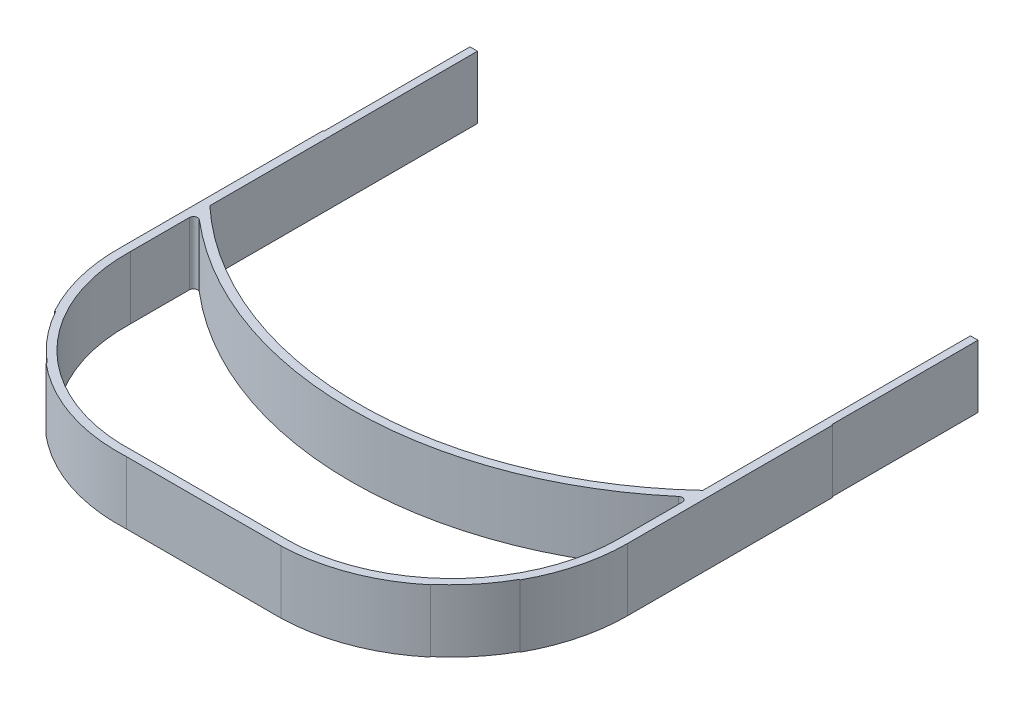
from build123d import *

# Parameters (mm, degrees)
EXTRUDE_THIN1_DEPTH = 19.05
CUT_EXTRUDE1_DEPTH  = 0.762
SKETCH5_W           = 0.254
SKETCH5_H           = 44.45
CUT_EXTRUDE2_DEPTH  = 179.926011423
FILLET1_R           = 1.27


# Read off the part's stored shape, not the designer's step: Extrude-Thin1
with BuildPart() as part:
    # Extrude-Thin1 outline → Extrude-Thin1 (new body)
    with BuildSketch(Plane(origin=(0, 0, 0), x_dir=(1, 0, 0), z_dir=(0, 1, 0))):
        with BuildLine():
            Line((-77.47, 0), (-77.47, -105.393461373))
            ThreePointArc((-77.47, -105.393461373), (-61.42554389, -144.940139978), (-21.525585689, -160.084699927))
            Line((-21.525585689, -160.084699927), (25.449585748, -160.084699927))
            ThreePointArc((25.449585748, -160.084699927), (62.312605028, -143.988244453), (77.47, -106.729266381))
            Line((77.47, -106.729266381), (77.47, 0))
            Line((77.47, 0), (74.93, 0))
            Line((74.93, 0), (74.93, -81.365537415))
            ThreePointArc((74.93, -81.365537415), (0, -110.930919203), (-74.93, -81.365537415))
            Line((-74.93, -81.365537415), (-74.93, 0))
            Line((-74.93, 0), (-77.47, 0))
        make_face()
        with BuildLine():
            ThreePointArc((-74.93, -84.808574146), (0, -113.470919203), (74.93, -84.808574146))
            Line((74.93, -84.808574146), (74.93, -106.729266381))
            ThreePointArc((74.93, -106.729266381), (60.505038847, -142.203708173), (25.417013871, -157.544699927))
            Line((25.417013871, -157.544699927), (-21.587996742, -157.544699927))
            ThreePointArc((-21.587996742, -157.544699927), (-59.63978466, -143.133796675), (-74.93, -105.426741485))
            Line((-74.93, -105.426741485), (-74.93, -84.808574146))
        make_face(mode=Mode.SUBTRACT)
    extrude(amount=EXTRUDE_THIN1_DEPTH)

    # Sketch4 → Cut-Extrude1 (cut, symmetric)
    # profile 1 of 11: a face of its own
    with BuildSketch(Plane.ZY.offset(77.47)):
        Polygon((64.086153846, 12.7), (66.561025641, 12.7), (66.561025641, 11.788205128), (64.997948718, 11.788205128), (64.997948718, 10.811282051), (66.561025641, 10.811282051), (66.561025641, 9.899487179), (64.997948718, 9.899487179), (64.997948718, 7.62), (64.086153846, 7.62), align=None)
    # profile 2 of 11: a face of its own
    with BuildSketch(Plane.ZY.offset(77.47)):
        with BuildLine():
            Line((67.472820513, 12.7), (68.535224359, 12.7))
            add(Edge.make_bspline(
                [(68.535224359, 12.7), (68.60544893, 12.699750743), (68.740510561, 12.699271352), (68.935262056, 12.691707827), (69.114168086, 12.681182562), (69.27749354, 12.665120728), (69.425168542, 12.643824678), (69.557341098, 12.618720159), (69.674007345, 12.590108177), (69.776151201, 12.55445539), (69.868330981, 12.514239587), (69.954255351, 12.468030891), (70.03581993, 12.416343853), (70.112479549, 12.357818444), (70.184900396, 12.293507524), (70.253219098, 12.223346356), (70.316470249, 12.146740004), (70.374262194, 12.064172522), (70.426934901, 11.977313424), (70.473486526, 11.886043452), (70.511342385, 11.790299134), (70.544792094, 11.691464182), (70.568884836, 11.588125732), (70.585640986, 11.481289801), (70.597909183, 11.370580314), (70.598614546, 11.295369204), (70.598974359, 11.257003205)],
                knots=[0, 0, 0, 0, 1.749336639, 3.364467119, 4.854658419, 6.213483162, 7.451590619, 8.570285859, 9.5643256, 10.440900261, 11.26203566, 12.067320669, 12.869050712, 13.665104639, 14.467235401, 15.27997916, 16.102287765, 16.939272006, 17.78853747, 18.631303466, 19.488103222, 20.351255419, 21.228522269, 22.127379805, 23.044756219, 24, 24, 24, 24], degree=3))
            add(Edge.make_bspline(
                [(70.598974359, 11.257003205), (70.598039694, 11.216957916), (70.596206986, 11.138436401), (70.586335024, 11.023094701), (70.568292179, 10.91274383), (70.540963665, 10.807706882), (70.509553088, 10.706676549), (70.467785077, 10.611516906), (70.42064575, 10.520843991), (70.364659747, 10.435940409), (70.303217844, 10.354920281), (70.231762204, 10.280887788), (70.154922054, 10.209863965), (70.06837793, 10.146297503), (69.975944776, 10.085890267), (69.875786044, 10.031145224), (69.768555404, 9.98068621), (69.693166953, 9.952546778), (69.654615385, 9.938157051)],
                knots=[0, 0, 0, 0, 1.099860209, 2.156625411, 3.176576793, 4.16617041, 5.135385252, 6.078461593, 7.016046972, 7.938469504, 8.868247731, 9.803980173, 10.76021508, 11.73834243, 12.748633912, 13.790971185, 14.870363756, 16, 16, 16, 16], degree=3))
            Line((69.654615385, 9.938157051), (70.826923077, 7.62))
            Line((70.826923077, 7.62), (69.813365385, 7.62))
            Line((69.813365385, 7.62), (68.693974359, 9.834358974))
            Line((68.693974359, 9.834358974), (68.384615385, 9.834358974))
            Line((68.384615385, 9.834358974), (68.384615385, 7.62))
            Line((68.384615385, 7.62), (67.472820513, 7.62))
            Line((67.472820513, 7.62), (67.472820513, 12.7))
        make_face()
        with BuildLine():
            Line((68.384615385, 10.746153846), (68.739767628, 10.746153846))
            add(Edge.make_bspline(
                [(68.739767628, 10.746153846), (68.783187942, 10.746642875), (68.866328514, 10.74757926), (68.985895575, 10.751922602), (69.094490982, 10.762387909), (69.19258108, 10.775610434), (69.280659449, 10.790877748), (69.357940462, 10.812756737), (69.425614901, 10.836200627), (69.48288082, 10.8653353), (69.531807506, 10.898467744), (69.574052568, 10.936107023), (69.608995291, 10.979669695), (69.637754935, 11.027971917), (69.660126811, 11.081440907), (69.676456566, 11.139489699), (69.685582485, 11.202779542), (69.686632453, 11.246458151), (69.687179487, 11.269214744)],
                knots=[0, 0, 0, 0, 1.688639943, 3.233382647, 4.650958383, 5.928841754, 7.082724185, 8.122798841, 9.049171256, 9.863274652, 10.613301712, 11.341792392, 12.054588806, 12.776240173, 13.521029143, 14.301969904, 15.115324896, 16, 16, 16, 16], degree=3))
            add(Edge.make_bspline(
                [(69.687179487, 11.269214744), (69.686145269, 11.296137453), (69.684113739, 11.349022128), (69.663954648, 11.425157516), (69.631865729, 11.495626026), (69.587880611, 11.560109265), (69.532487074, 11.616639723), (69.468918619, 11.666471773), (69.395803286, 11.705875229), (69.32810399, 11.731865329), (69.266513455, 11.747415474), (69.21092994, 11.759003304), (69.146563895, 11.767215932), (69.073366727, 11.775926886), (68.991525018, 11.781575499), (68.900592682, 11.78569786), (68.800830876, 11.787384521), (68.731287423, 11.787923717), (68.694991987, 11.788205128)],
                knots=[0, 0, 0, 0, 1.020303359, 2.004196876, 2.966617323, 3.9489082, 4.950758222, 5.960522915, 7.003732012, 8.091992268, 8.70421221, 9.413913587, 10.24622431, 11.166358409, 12.212345909, 13.359657661, 14.621978493, 16, 16, 16, 16], degree=3))
            Line((68.694991987, 11.788205128), (68.384615385, 11.788205128))
            Line((68.384615385, 11.788205128), (68.384615385, 10.746153846))
        make_face(mode=Mode.SUBTRACT)
    # profile 3 of 11: a face of its own
    with BuildSketch(Plane.ZY.offset(77.47)):
        Polygon((71.575897436, 12.7), (74.311282051, 12.7), (74.311282051, 11.788205128), (72.487692308, 11.788205128), (72.487692308, 10.811282051), (74.311282051, 10.811282051), (74.311282051, 9.899487179), (72.487692308, 9.899487179), (72.487692308, 8.531794872), (74.311282051, 8.531794872), (74.311282051, 7.62), (71.575897436, 7.62), align=None)
    # profile 4 of 11: a face of its own
    with BuildSketch(Plane.ZY.offset(77.47)):
        with BuildLine():
            Line((77.828205128, 12.021241987), (77.146394231, 11.397435897))
            add(Edge.make_bspline(
                [(77.146394231, 11.397435897), (77.117188375, 11.438633793), (77.061117206, 11.517728006), (76.970231689, 11.623637022), (76.879756567, 11.713985295), (76.788853642, 11.78839539), (76.696717186, 11.846415212), (76.603507135, 11.887493886), (76.509751921, 11.913607989), (76.44676289, 11.916859824), (76.415737179, 11.918461538)],
                knots=[0, 0, 0, 0, 1.299362458, 2.494594718, 3.587462134, 4.587049575, 5.512617175, 6.380583204, 7.202344345, 8, 8, 8, 8], degree=3))
            add(Edge.make_bspline(
                [(76.415737179, 11.918461538), (76.386797287, 11.917446618), (76.330921957, 11.915487075), (76.251267529, 11.896009355), (76.180549193, 11.862393671), (76.118835968, 11.818438335), (76.069949989, 11.765482347), (76.030918326, 11.709945132), (76.008940219, 11.648644606), (76.006047468, 11.606540932), (76.004615385, 11.585697115)],
                knots=[0, 0, 0, 0, 1.185010067, 2.2879431, 3.333075148, 4.379039566, 5.372662701, 6.27520591, 7.14612461, 8, 8, 8, 8], degree=3))
            add(Edge.make_bspline(
                [(76.004615385, 11.585697115), (76.005512799, 11.564552722), (76.007320066, 11.521970852), (76.024775808, 11.459561819), (76.051086595, 11.398580928), (76.076227627, 11.361458959), (76.089078526, 11.342483974)],
                knots=[0, 0, 0, 0, 0.967525499, 1.948461899, 2.951351359, 4, 4, 4, 4], degree=3))
            add(Edge.make_bspline(
                [(76.089078526, 11.342483974), (76.100761383, 11.327734918), (76.127653777, 11.293784537), (76.178932065, 11.240012426), (76.243326826, 11.174136884), (76.323316104, 11.098423176), (76.415579326, 11.010148343), (76.524393012, 10.912782501), (76.646625027, 10.803310344), (76.733504712, 10.727077898), (76.779030449, 10.68713141)],
                knots=[0, 0, 0, 0, 0.473873513, 1.090794244, 1.870441696, 2.795289791, 3.865433203, 5.087734844, 6.473946851, 8, 8, 8, 8], degree=3))
            add(Edge.make_bspline(
                [(76.779030449, 10.68713141), (76.821762901, 10.650148628), (76.902860219, 10.57996299), (77.018245597, 10.480345747), (77.119650127, 10.390722542), (77.208551041, 10.312438428), (77.283600689, 10.244672026), (77.34511458, 10.187099412), (77.393844001, 10.14084142), (77.421543823, 10.112901565), (77.433365385, 10.100977564)],
                knots=[0, 0, 0, 0, 1.543621617, 2.929473131, 4.163658386, 5.240097082, 6.164993805, 6.925417477, 7.541396219, 8, 8, 8, 8], degree=3))
            add(Edge.make_bspline(
                [(77.433365385, 10.100977564), (77.478213924, 10.052441839), (77.564428568, 9.95913913), (77.676477212, 9.814549275), (77.76869687, 9.673400093), (77.840039747, 9.533035635), (77.893920756, 9.391430721), (77.931907582, 9.245112497), (77.954658145, 9.092552029), (77.957183988, 8.988448135), (77.958461538, 8.935793269)],
                knots=[0, 0, 0, 0, 1.206664779, 2.319633467, 3.337109185, 4.282041471, 5.190008762, 6.099243693, 7.03861361, 8, 8, 8, 8], degree=3))
            add(Edge.make_bspline(
                [(77.958461538, 8.935793269), (77.957552211, 8.88448756), (77.955768076, 8.78382385), (77.93391585, 8.636517505), (77.902755858, 8.495538939), (77.854577044, 8.362422199), (77.795856991, 8.234982214), (77.722242923, 8.115204094), (77.635793295, 8.001875635), (77.536708747, 7.897022722), (77.427109472, 7.801875971), (77.309553833, 7.717174087), (77.182892311, 7.647241892), (77.048207085, 7.589657717), (76.905570246, 7.545305616), (76.755151719, 7.51252528), (76.596721429, 7.492851039), (76.488384513, 7.49079433), (76.433036859, 7.48974359)],
                knots=[0, 0, 0, 0, 1.043214005, 2.046824704, 3.02475056, 3.976699089, 4.921714032, 5.875962561, 6.831408892, 7.817874052, 8.806269674, 9.781291748, 10.760897367, 11.74438705, 12.757449933, 13.795994037, 14.874007457, 16, 16, 16, 16], degree=3))
            add(Edge.make_bspline(
                [(76.433036859, 7.48974359), (76.389589422, 7.490514376), (76.30353858, 7.492040975), (76.176712647, 7.504504388), (76.054247873, 7.524619009), (75.936282202, 7.553449271), (75.822284178, 7.589981122), (75.712249119, 7.634603379), (75.606936635, 7.68800767), (75.505549881, 7.74909579), (75.408581721, 7.820027144), (75.314806031, 7.899351564), (75.225154281, 7.988289095), (75.139195891, 8.086629403), (75.057480848, 8.194650964), (74.977334324, 8.310849378), (74.902318272, 8.43738113), (74.85597752, 8.526144178), (74.832307692, 8.571482372)],
                knots=[0, 0, 0, 0, 1.016823716, 2.013894106, 2.979844003, 3.91962641, 4.853723003, 5.779685073, 6.695824784, 7.614987388, 8.547259901, 9.504950863, 10.487499108, 11.500346958, 12.559593716, 13.656357062, 14.802919212, 16, 16, 16, 16], degree=3))
            Line((74.832307692, 8.571482372), (75.634198718, 9.052820513))
            add(Edge.make_bspline(
                [(75.634198718, 9.052820513), (75.663806135, 9.001355739), (75.720566083, 8.902693368), (75.816751121, 8.770127968), (75.915287782, 8.656607646), (76.018454146, 8.564138883), (76.124995747, 8.49148525), (76.235427207, 8.439561923), (76.349826113, 8.407421443), (76.427749451, 8.403496348), (76.46661859, 8.401538462)],
                knots=[0, 0, 0, 0, 1.283663364, 2.460892379, 3.537111102, 4.529833553, 5.449777664, 6.316464042, 7.160231139, 8, 8, 8, 8], degree=3))
            add(Edge.make_bspline(
                [(76.46661859, 8.401538462), (76.506154068, 8.403137378), (76.582858655, 8.406239509), (76.692344637, 8.434892954), (76.792725531, 8.479880966), (76.879494035, 8.544072654), (76.952964133, 8.61815962), (77.007189282, 8.700584756), (77.041253887, 8.789766764), (77.044855341, 8.851718453), (77.046666667, 8.882876603)],
                knots=[0, 0, 0, 0, 1.13588714, 2.203786484, 3.234766741, 4.283437687, 5.291419208, 6.222934724, 7.106237994, 8, 8, 8, 8], degree=3))
            add(Edge.make_bspline(
                [(77.046666667, 8.882876603), (77.044993982, 8.91186419), (77.041596083, 8.9707497), (77.016568206, 9.058302984), (76.977442001, 9.145816451), (76.931152941, 9.217597364), (76.884048027, 9.277697576), (76.839005104, 9.329771692), (76.784154739, 9.387304473), (76.719636009, 9.450368292), (76.646301374, 9.519518314), (76.56408906, 9.59474777), (76.472057647, 9.675393977), (76.407009663, 9.730329377), (76.372996795, 9.759054487)],
                knots=[0, 0, 0, 0, 0.916159276, 1.861089862, 2.860218735, 3.940849679, 4.552606315, 5.27541173, 6.11797699, 7.06649574, 8.129236253, 9.306560635, 10.591630461, 12, 12, 12, 12], degree=3))
            add(Edge.make_bspline(
                [(76.372996795, 9.759054487), (76.308336978, 9.813762893), (76.184235218, 9.918764882), (76.008863687, 10.073849514), (75.850838235, 10.218790313), (75.711523739, 10.355379064), (75.589145118, 10.481093289), (75.484531172, 10.596954088), (75.398831134, 10.703855168), (75.308650322, 10.830472343), (75.222960521, 10.984764071), (75.148900217, 11.170394906), (75.100853017, 11.356002187), (75.095469996, 11.480608693), (75.092820513, 11.541939103)],
                knots=[0, 0, 0, 0, 1.345494975, 2.582412109, 3.71882943, 4.751509156, 5.681369928, 6.505683931, 7.230279997, 7.856715994, 8.973648664, 10.023341002, 11.027102913, 12, 12, 12, 12], degree=3))
            add(Edge.make_bspline(
                [(75.092820513, 11.541939103), (75.093922429, 11.585431337), (75.096093323, 11.671115712), (75.115458033, 11.7971021), (75.144399329, 11.918668378), (75.186430399, 12.035371018), (75.240981654, 12.147063845), (75.307232033, 12.254293642), (75.386210281, 12.35607349), (75.475213434, 12.452335916), (75.573272121, 12.54030882), (75.67806029, 12.617953722), (75.788984831, 12.683533735), (75.905367162, 12.737937118), (76.027928457, 12.779579451), (76.155765813, 12.809097613), (76.289062589, 12.826654074), (76.379728178, 12.829040672), (76.425913462, 12.83025641)],
                knots=[0, 0, 0, 0, 1.010766082, 1.991317756, 2.957454644, 3.913069143, 4.869106762, 5.843196583, 6.838735724, 7.860187025, 8.887984031, 9.89767229, 10.887916223, 11.879572884, 12.879850636, 13.892031539, 14.926195476, 16, 16, 16, 16], degree=3))
            add(Edge.make_bspline(
                [(76.425913462, 12.83025641), (76.485767303, 12.828066829), (76.605002519, 12.823704951), (76.781295227, 12.789596488), (76.953490572, 12.735957338), (77.092248809, 12.671247604), (77.202656147, 12.608563255), (77.287273059, 12.550851402), (77.373375321, 12.484739372), (77.461657295, 12.41001883), (77.550478566, 12.325281942), (77.642364746, 12.232545936), (77.736063774, 12.131009356), (77.796953286, 12.058472095), (77.828205128, 12.021241987)],
                knots=[0, 0, 0, 0, 1.282922637, 2.555718331, 3.837320111, 5.142675274, 5.830281639, 6.55870424, 7.337177975, 8.157850921, 9.037902056, 9.96903443, 10.957596896, 12, 12, 12, 12], degree=3))
        make_face()
    # profile 5 of 11: a face of its own
    with BuildSketch(Plane.ZY.offset(77.47)):
        Polygon((78.87025641, 12.7), (79.691482372, 12.7), (81.996410256, 9.357091346), (81.996410256, 12.7), (82.908205128, 12.7), (82.908205128, 7.62), (82.080873397, 7.62), (79.782051282, 10.952732372), (79.782051282, 7.62), (78.87025641, 7.62), align=None)
    # profile 6 of 11: a face of its own
    with BuildSketch(Plane.ZY.offset(77.47)):
        with BuildLine():
            add(Edge.make_bspline(
                [(86.46786859, 12.83025641), (86.556190616, 12.827969595), (86.730558299, 12.823454903), (86.986990239, 12.785821425), (87.234109827, 12.724503068), (87.471805317, 12.639266117), (87.699481546, 12.527801922), (87.917941604, 12.393270565), (88.126402979, 12.233132849), (88.322729525, 12.051124521), (88.504170661, 11.853198413), (88.661389512, 11.640095768), (88.79545998, 11.417338291), (88.906577943, 11.184329097), (88.991214954, 10.939454486), (89.050608245, 10.683962995), (89.088765492, 10.417927308), (89.093154163, 10.236793266), (89.095384615, 10.144735577)],
                knots=[0, 0, 0, 0, 1.014329547, 2.002516266, 2.970391464, 3.935626869, 4.897733899, 5.877609409, 6.878433252, 7.912639331, 8.949961323, 9.958554974, 10.949718813, 11.932905612, 12.9188844, 13.919928257, 14.942845884, 16, 16, 16, 16], degree=3))
            add(Edge.make_bspline(
                [(89.095384615, 10.144735577), (89.09300928, 10.053715165), (89.088328606, 9.874356524), (89.052165991, 9.610772461), (88.991772509, 9.358017816), (88.908571008, 9.115520472), (88.799468305, 8.884455005), (88.668012357, 8.663346093), (88.510734292, 8.454245679), (88.333370657, 8.257265975), (88.138108687, 8.078464627), (87.931295264, 7.920896248), (87.713885324, 7.787378749), (87.486197086, 7.677973289), (87.247742283, 7.593067741), (86.999109928, 7.533160707), (86.740315405, 7.496753993), (86.56432258, 7.492103892), (86.474991987, 7.48974359)],
                knots=[0, 0, 0, 0, 1.051557043, 2.072126891, 3.067553643, 4.050577992, 5.02905126, 6.015227836, 7.017913613, 8.04756643, 9.074058332, 10.072836633, 11.047628519, 12.017157415, 12.98668631, 13.966869689, 14.968021931, 16, 16, 16, 16], degree=3))
            add(Edge.make_bspline(
                [(86.474991987, 7.48974359), (86.381562898, 7.491860897), (86.197987509, 7.496021117), (85.929324105, 7.535582908), (85.67192135, 7.595176785), (85.427941575, 7.684117449), (85.194900054, 7.795300758), (84.974509012, 7.932229669), (84.766842514, 8.094677896), (84.573091771, 8.278485081), (84.397553128, 8.479610455), (84.242605843, 8.692081578), (84.111904371, 8.914275356), (84.00544393, 9.146295781), (83.921514795, 9.386700903), (83.862312327, 9.636954858), (83.827340016, 9.896457445), (83.822468576, 10.072716791), (83.82, 10.162035256)],
                knots=[0, 0, 0, 0, 1.067978421, 2.098431617, 3.099715153, 4.085208694, 5.062210972, 6.048429807, 7.046490867, 8.072918869, 9.098532598, 10.095778865, 11.076610158, 12.041847152, 13.011192615, 13.984257998, 14.978533688, 16, 16, 16, 16], degree=3))
            add(Edge.make_bspline(
                [(83.82, 10.162035256), (83.820774781, 10.222124044), (83.822314533, 10.341540759), (83.840862468, 10.518510233), (83.867566162, 10.692025501), (83.907059658, 10.861394755), (83.955034161, 11.027812816), (84.017191907, 11.189730622), (84.087944244, 11.348877903), (84.170611687, 11.503374929), (84.262529891, 11.651800198), (84.362820835, 11.793453563), (84.4717367, 11.926622227), (84.588926631, 12.05218132), (84.714794481, 12.169305533), (84.847684588, 12.279652922), (84.990174247, 12.380292268), (85.139144806, 12.473681385), (85.293756403, 12.558131543), (85.453379628, 12.630012993), (85.614725929, 12.692785838), (85.779950674, 12.742328943), (85.947283185, 12.782681284), (86.118511073, 12.809366979), (86.292087389, 12.827914401), (86.409135802, 12.829473888), (86.46786859, 12.83025641)],
                knots=[0, 0, 0, 0, 1.034744296, 2.056386356, 3.06226378, 4.057406941, 5.050368692, 6.043467995, 7.042652155, 8.049140477, 9.059438543, 10.048523776, 11.036952808, 12.020949711, 13.004946614, 13.997082645, 14.994316842, 16.007702937, 17.024872941, 18.026463647, 19.021641123, 20.005082605, 20.995858141, 21.984425357, 22.988620895, 24, 24, 24, 24], degree=3))
        make_face()
        with BuildLine():
            add(Edge.make_bspline(
                [(86.453621795, 11.918461538), (86.394181083, 11.916866611), (86.276868904, 11.913718862), (86.104793302, 11.88973727), (85.939594647, 11.851435943), (85.782188701, 11.795956939), (85.631893253, 11.725346248), (85.488441875, 11.639850591), (85.353821072, 11.536531152), (85.226235806, 11.42093469), (85.110983513, 11.292133665), (85.009154476, 11.154101463), (84.923939974, 11.007068593), (84.852572294, 10.852400958), (84.798848249, 10.68835936), (84.760582222, 10.516228755), (84.736399521, 10.335712553), (84.733351262, 10.212654893), (84.731794872, 10.149823718)],
                knots=[0, 0, 0, 0, 1.033739768, 2.040188636, 3.016340934, 3.979330865, 4.937572243, 5.900995986, 6.878200029, 7.884839167, 8.891893314, 9.879764717, 10.863503415, 11.843163062, 12.837761627, 13.859916423, 14.907309254, 16, 16, 16, 16], degree=3))
            add(Edge.make_bspline(
                [(84.731794872, 10.149823718), (84.733858407, 10.080192642), (84.737902595, 9.943727271), (84.766357994, 9.744655264), (84.815042348, 9.556651512), (84.885341609, 9.380635512), (84.972531136, 9.214652738), (85.08080669, 9.060737547), (85.208414721, 8.917968364), (85.306722914, 8.834613768), (85.35661859, 8.792307692)],
                knots=[0, 0, 0, 0, 1.078454662, 2.113592447, 3.107694534, 4.079536787, 5.043276885, 6.005368276, 6.987637804, 8, 8, 8, 8], degree=3))
            add(Edge.make_bspline(
                [(85.35661859, 8.792307692), (85.397492674, 8.761053588), (85.478319942, 8.69924954), (85.60733786, 8.620034974), (85.740200911, 8.552140189), (85.877911713, 8.497282005), (86.020179427, 8.45413148), (86.166984546, 8.423913877), (86.318119057, 8.404949718), (86.420323296, 8.402683142), (86.471939103, 8.401538462)],
                knots=[0, 0, 0, 0, 1.023928204, 2.024787132, 3.009472467, 3.9914905, 4.972207045, 5.96565515, 6.972602802, 8, 8, 8, 8], degree=3))
            add(Edge.make_bspline(
                [(86.471939103, 8.401538462), (86.53035773, 8.403146913), (86.645298216, 8.40631159), (86.814170538, 8.429997955), (86.975955351, 8.470083836), (87.13165703, 8.525076158), (87.2808266, 8.596573428), (87.422735029, 8.684720892), (87.557631121, 8.788436212), (87.685053845, 8.905550709), (87.801524238, 9.034859121), (87.903140778, 9.173627573), (87.991064676, 9.318798581), (88.060948264, 9.472426822), (88.116794825, 9.633062115), (88.1546003, 9.801415881), (88.178987289, 9.976794101), (88.182036408, 10.096145177), (88.183589744, 10.156947115)],
                knots=[0, 0, 0, 0, 1.026359118, 2.019393844, 2.989460624, 3.950973911, 4.916101784, 5.890408035, 6.881132271, 7.902007068, 8.92769091, 9.933912415, 10.920395702, 11.90457117, 12.894218921, 13.903490204, 14.931958862, 16, 16, 16, 16], degree=3))
            add(Edge.make_bspline(
                [(88.183589744, 10.156947115), (88.181982662, 10.217399426), (88.178819367, 10.336390579), (88.155091313, 10.511317903), (88.115259647, 10.678928436), (88.060102188, 10.839495905), (87.989669034, 10.993177724), (87.902571294, 11.139433459), (87.799114583, 11.278121714), (87.68167995, 11.408297384), (87.553859571, 11.527920486), (87.416631621, 11.631731593), (87.273835894, 11.721940144), (87.122195959, 11.792605881), (86.964814242, 11.848905123), (86.800730392, 11.890364693), (86.629322929, 11.91355039), (86.512710889, 11.916809897), (86.453621795, 11.918461538)],
                knots=[0, 0, 0, 0, 1.055025985, 2.07665775, 3.074803781, 4.057872707, 5.035505728, 6.020516407, 7.023567878, 8.050795229, 9.077271434, 10.074415901, 11.050397877, 12.019801805, 12.988065821, 13.964604439, 14.968634123, 16, 16, 16, 16], degree=3))
        make_face(mode=Mode.SUBTRACT)
    # profile 7 of 11: a face of its own
    with BuildSketch(Plane.ZY.offset(77.47)):
        with BuildLine():
            Line((94.566153846, 12.021241987), (93.884342949, 11.397435897))
            add(Edge.make_bspline(
                [(93.884342949, 11.397435897), (93.855137093, 11.438633793), (93.799065924, 11.517728006), (93.708180407, 11.623637022), (93.617705285, 11.713985295), (93.52680236, 11.78839539), (93.434665904, 11.846415212), (93.341455853, 11.887493886), (93.247700639, 11.913607989), (93.184711608, 11.916859824), (93.153685897, 11.918461538)],
                knots=[0, 0, 0, 0, 1.299362458, 2.494594718, 3.587462134, 4.587049575, 5.512617175, 6.380583204, 7.202344345, 8, 8, 8, 8], degree=3))
            add(Edge.make_bspline(
                [(93.153685897, 11.918461538), (93.124746005, 11.917446618), (93.068870675, 11.915487075), (92.989216247, 11.896009355), (92.918497911, 11.862393671), (92.856784686, 11.818438335), (92.807898707, 11.765482347), (92.768867044, 11.709945132), (92.746888937, 11.648644606), (92.743996186, 11.606540932), (92.742564103, 11.585697115)],
                knots=[0, 0, 0, 0, 1.185010067, 2.2879431, 3.333075148, 4.379039566, 5.372662701, 6.27520591, 7.14612461, 8, 8, 8, 8], degree=3))
            add(Edge.make_bspline(
                [(92.742564103, 11.585697115), (92.743461517, 11.564552722), (92.745268784, 11.521970852), (92.762724526, 11.459561819), (92.789035313, 11.398580928), (92.814176345, 11.361458959), (92.827027244, 11.342483974)],
                knots=[0, 0, 0, 0, 0.967525499, 1.948461899, 2.951351359, 4, 4, 4, 4], degree=3))
            add(Edge.make_bspline(
                [(92.827027244, 11.342483974), (92.838710101, 11.327734918), (92.865602495, 11.293784537), (92.916880783, 11.240012426), (92.981275543, 11.174136884), (93.061264822, 11.098423176), (93.153528044, 11.010148343), (93.26234173, 10.912782501), (93.384573745, 10.803310344), (93.47145343, 10.727077898), (93.516979167, 10.68713141)],
                knots=[0, 0, 0, 0, 0.473873513, 1.090794244, 1.870441696, 2.795289791, 3.865433203, 5.087734844, 6.473946851, 8, 8, 8, 8], degree=3))
            add(Edge.make_bspline(
                [(93.516979167, 10.68713141), (93.559711619, 10.650148628), (93.640808937, 10.57996299), (93.756194314, 10.480345747), (93.857598844, 10.390722542), (93.946499759, 10.312438428), (94.021549407, 10.244672026), (94.083063298, 10.187099412), (94.131792718, 10.14084142), (94.159492541, 10.112901565), (94.171314103, 10.100977564)],
                knots=[0, 0, 0, 0, 1.543621617, 2.929473131, 4.163658386, 5.240097082, 6.164993805, 6.925417477, 7.541396219, 8, 8, 8, 8], degree=3))
            add(Edge.make_bspline(
                [(94.171314103, 10.100977564), (94.216162642, 10.052441839), (94.302377286, 9.95913913), (94.41442593, 9.814549275), (94.506645588, 9.673400093), (94.577988465, 9.533035635), (94.631869474, 9.391430721), (94.6698563, 9.245112497), (94.692606863, 9.092552029), (94.695132706, 8.988448135), (94.696410256, 8.935793269)],
                knots=[0, 0, 0, 0, 1.206664779, 2.319633467, 3.337109185, 4.282041471, 5.190008762, 6.099243693, 7.03861361, 8, 8, 8, 8], degree=3))
            add(Edge.make_bspline(
                [(94.696410256, 8.935793269), (94.695500929, 8.88448756), (94.693716794, 8.78382385), (94.671864568, 8.636517505), (94.640704576, 8.495538939), (94.592525762, 8.362422199), (94.533805709, 8.234982214), (94.460191641, 8.115204094), (94.373742013, 8.001875635), (94.274657465, 7.897022722), (94.16505819, 7.801875971), (94.04750255, 7.717174087), (93.920841029, 7.647241892), (93.786155803, 7.589657717), (93.643518964, 7.545305616), (93.493100437, 7.51252528), (93.334670147, 7.492851039), (93.226333231, 7.49079433), (93.170985577, 7.48974359)],
                knots=[0, 0, 0, 0, 1.043214005, 2.046824704, 3.02475056, 3.976699089, 4.921714032, 5.875962561, 6.831408892, 7.817874052, 8.806269674, 9.781291748, 10.760897367, 11.74438705, 12.757449933, 13.795994037, 14.874007457, 16, 16, 16, 16], degree=3))
            add(Edge.make_bspline(
                [(93.170985577, 7.48974359), (93.12753814, 7.490514376), (93.041487298, 7.492040975), (92.914661365, 7.504504388), (92.792196591, 7.524619009), (92.67423092, 7.553449271), (92.560232896, 7.589981122), (92.450197837, 7.634603379), (92.344885353, 7.68800767), (92.243498599, 7.74909579), (92.146530439, 7.820027144), (92.052754749, 7.899351564), (91.963102999, 7.988289095), (91.877144609, 8.086629403), (91.795429566, 8.194650964), (91.715283042, 8.310849378), (91.64026699, 8.43738113), (91.593926238, 8.526144178), (91.57025641, 8.571482372)],
                knots=[0, 0, 0, 0, 1.016823716, 2.013894106, 2.979844003, 3.91962641, 4.853723003, 5.779685073, 6.695824784, 7.614987388, 8.547259901, 9.504950863, 10.487499108, 11.500346958, 12.559593716, 13.656357062, 14.802919212, 16, 16, 16, 16], degree=3))
            Line((91.57025641, 8.571482372), (92.372147436, 9.052820513))
            add(Edge.make_bspline(
                [(92.372147436, 9.052820513), (92.401754852, 9.001355739), (92.4585148, 8.902693368), (92.554699839, 8.770127968), (92.6532365, 8.656607646), (92.756402864, 8.564138883), (92.862944465, 8.49148525), (92.973375925, 8.439561923), (93.087774831, 8.407421443), (93.165698169, 8.403496348), (93.204567308, 8.401538462)],
                knots=[0, 0, 0, 0, 1.283663364, 2.460892379, 3.537111102, 4.529833553, 5.449777664, 6.316464042, 7.160231139, 8, 8, 8, 8], degree=3))
            add(Edge.make_bspline(
                [(93.204567308, 8.401538462), (93.244102786, 8.403137378), (93.320807373, 8.406239509), (93.430293355, 8.434892954), (93.530674249, 8.479880966), (93.617442753, 8.544072654), (93.690912851, 8.61815962), (93.745138, 8.700584756), (93.779202605, 8.789766764), (93.782804059, 8.851718453), (93.784615385, 8.882876603)],
                knots=[0, 0, 0, 0, 1.13588714, 2.203786484, 3.234766741, 4.283437687, 5.291419208, 6.222934724, 7.106237994, 8, 8, 8, 8], degree=3))
            add(Edge.make_bspline(
                [(93.784615385, 8.882876603), (93.7829427, 8.91186419), (93.779544801, 8.9707497), (93.754516924, 9.058302984), (93.715390719, 9.145816451), (93.669101659, 9.217597364), (93.621996745, 9.277697576), (93.576953822, 9.329771692), (93.522103457, 9.387304473), (93.457584727, 9.450368292), (93.384250092, 9.519518314), (93.302037778, 9.59474777), (93.210006365, 9.675393977), (93.144958381, 9.730329377), (93.110945513, 9.759054487)],
                knots=[0, 0, 0, 0, 0.916159276, 1.861089862, 2.860218735, 3.940849679, 4.552606315, 5.27541173, 6.11797699, 7.06649574, 8.129236253, 9.306560635, 10.591630461, 12, 12, 12, 12], degree=3))
            add(Edge.make_bspline(
                [(93.110945513, 9.759054487), (93.046285696, 9.813762893), (92.922183936, 9.918764882), (92.746812405, 10.073849514), (92.588786953, 10.218790313), (92.449472457, 10.355379064), (92.327093836, 10.481093289), (92.22247989, 10.596954088), (92.136779852, 10.703855168), (92.04659904, 10.830472343), (91.960909239, 10.984764071), (91.886848934, 11.170394906), (91.838801735, 11.356002187), (91.833418714, 11.480608693), (91.830769231, 11.541939103)],
                knots=[0, 0, 0, 0, 1.345494975, 2.582412109, 3.71882943, 4.751509156, 5.681369928, 6.505683931, 7.230279997, 7.856715994, 8.973648664, 10.023341002, 11.027102913, 12, 12, 12, 12], degree=3))
            add(Edge.make_bspline(
                [(91.830769231, 11.541939103), (91.831871147, 11.585431337), (91.834042041, 11.671115712), (91.853406751, 11.7971021), (91.882348047, 11.918668378), (91.924379117, 12.035371018), (91.978930372, 12.147063845), (92.045180751, 12.254293642), (92.124158999, 12.35607349), (92.213162152, 12.452335916), (92.311220839, 12.54030882), (92.416009008, 12.617953722), (92.526933549, 12.683533735), (92.64331588, 12.737937118), (92.765877175, 12.779579451), (92.893714531, 12.809097613), (93.027011307, 12.826654074), (93.117676896, 12.829040672), (93.163862179, 12.83025641)],
                knots=[0, 0, 0, 0, 1.010766082, 1.991317756, 2.957454644, 3.913069143, 4.869106762, 5.843196583, 6.838735724, 7.860187025, 8.887984031, 9.89767229, 10.887916223, 11.879572884, 12.879850636, 13.892031539, 14.926195476, 16, 16, 16, 16], degree=3))
            add(Edge.make_bspline(
                [(93.163862179, 12.83025641), (93.223716021, 12.828066829), (93.342951237, 12.823704951), (93.519243944, 12.789596488), (93.69143929, 12.735957338), (93.830197527, 12.671247604), (93.940604865, 12.608563255), (94.025221777, 12.550851402), (94.111324039, 12.484739372), (94.199606013, 12.41001883), (94.288427284, 12.325281942), (94.380313464, 12.232545936), (94.474012492, 12.131009356), (94.534902004, 12.058472095), (94.566153846, 12.021241987)],
                knots=[0, 0, 0, 0, 1.282922637, 2.555718331, 3.837320111, 5.142675274, 5.830281639, 6.55870424, 7.337177975, 8.157850921, 9.037902056, 9.96903443, 10.957596896, 12, 12, 12, 12], degree=3))
        make_face()
    # profile 8 of 11: a face of its own
    with BuildSketch(Plane.ZY.offset(77.47)):
        Polygon((95.087179487, 12.7), (97.822564103, 12.7), (97.822564103, 11.788205128), (96.910769231, 11.788205128), (96.910769231, 7.62), (95.998974359, 7.62), (95.998974359, 11.788205128), (95.087179487, 11.788205128), align=None)
    # profile 9 of 11: a face of its own
    with BuildSketch(Plane.ZY.offset(77.47)):
        Polygon((100.10306891, 12.7), (100.948717949, 12.7), (103.00025641, 7.62), (102.026386218, 7.62), (101.631546474, 8.662051282), (99.418205128, 8.662051282), (99.023365385, 7.62), (98.050512821, 7.62), align=None)
        Polygon((100.525384615, 11.337395833), (99.764198718, 9.573846154), (101.286570513, 9.573846154), align=None, mode=Mode.SUBTRACT)
    # profile 10 of 11: a face of its own
    with BuildSketch(Plane.ZY.offset(77.47)):
        Polygon((103.228205128, 12.7), (105.963589744, 12.7), (105.963589744, 11.788205128), (105.051794872, 11.788205128), (105.051794872, 7.62), (104.14, 7.62), (104.14, 11.788205128), (103.228205128, 11.788205128), align=None)
    # profile 11 of 11: a face of its own
    with BuildSketch(Plane.ZY.offset(77.47)):
        Polygon((106.68, 12.7), (109.415384615, 12.7), (109.415384615, 11.788205128), (107.591794872, 11.788205128), (107.591794872, 10.811282051), (109.415384615, 10.811282051), (109.415384615, 9.899487179), (107.591794872, 9.899487179), (107.591794872, 8.531794872), (109.415384615, 8.531794872), (109.415384615, 7.62), (106.68, 7.62), align=None)
    extrude(amount=CUT_EXTRUDE1_DEPTH, both=True, mode=Mode.SUBTRACT)

    # Sketch5 → Cut-Extrude2 (cut, through all)
    with BuildSketch(Plane(origin=(0, 19.05, 0), x_dir=(1, 0, 0), z_dir=(0, 1, 0))):
        with BuildLine():
            ThreePointArc((-70.769376009, -132.698535836), (-65.283919589, -140.742294585), (-58.428518689, -147.655742744))
            Line((-58.428518689, -147.655742744), (-58.265222194, -147.461191325))
            ThreePointArc((-58.265222194, -147.461191325), (-65.087998245, -140.580644261), (-70.547349382, -132.575165755))
            Line((-70.547349382, -132.575165755), (-70.769376009, -132.698535836))
        make_face()
        with Locations((-77.343, -22.225)):
            Rectangle(SKETCH5_W, SKETCH5_H)
    cut_extrude2 = extrude(amount=-CUT_EXTRUDE2_DEPTH, mode=Mode.SUBTRACT)

    # Mirror1: Cut-Extrude2 across plane
    add(cut_extrude2.mirror(Plane(origin=(0, 0, 0), x_dir=(0, 0, 1), z_dir=(1, 0, 0))), mode=Mode.SUBTRACT)

    # Fillet1
    fillet1_edges = [part.edges().sort_by_distance(p)[0] for p in [
        (-74.93, 9.525, 84.808574146),
        (74.93, 9.525, 84.808574146),
    ]]
    fillet(fillet1_edges, radius=FILLET1_R)


solid = part.part
